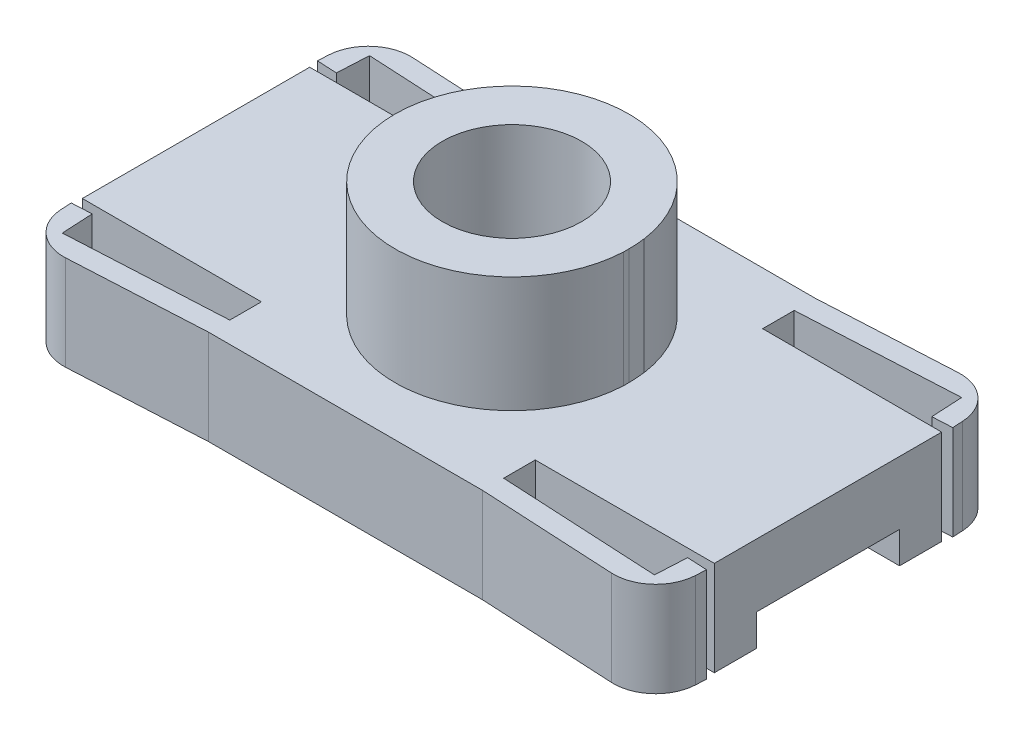
from build123d import *
from build123d.topology import SkipClean

# Parameters (mm, degrees)
BOSS_EXTRU_1_DEPTH       = 4.5
BOSS_EXTRU_2_DEPTH       = 5.5
ENL_V_MAT_EXTRU_3_DEPTH  = 2.1
ENL_V_START              = -13.1
ESQUISSE7_R              = 3
ENL_V_MAT_EXTRU_4_DEPTH  = 13.1
ESQUISSE18_W             = 8
ESQUISSE18_H             = 6.792682927
ENL_V_MAT_EXTRU_5_DEPTH  = 1.5
ESQUISSE19_W             = 8
ESQUISSE19_H             = 6.792682927
ENL_V_MAT_EXTRU_6_DEPTH  = 1.5
BOSS_EXTRU_11_DEPTH      = 4.5
ESQUISSE25_W             = 0.947664044
ESQUISSE25_H             = 4.5
BOSS_EXTRU_12_DEPTH      = 1.5
CONG_16_R                = 2
BOSS_EXTRU_16_DEPTH      = 1
ENL_V_MAT_EXTRU_7_DEPTH  = 0.25
CONG_16_OF_SYM_TRIE4_R   = 2
SYM_TRIE5_DEPTH          = 4.5
ESQUISSE34_W             = 0.75
ESQUISSE34_H             = 11.333514389
ENL_V_MAT_EXTRU_10_DEPTH = 36
ESQUISSE35_R             = 5.54436651
ESQUISSE35_R_2           = 3
BOSS_EXTRU_19_DEPTH      = 5.5
ESQUISSE36_W             = 0.010434814
ESQUISSE36_H             = 5.5
ENL_V_MAT_EXTRU_11_DEPTH = 0.25
BOSS_EXTRU_20_DEPTH      = 5.5
ESQUISSE38_W             = 0.005685697
ESQUISSE38_H             = 5.5
ENL_V_MAT_EXTRU_12_DEPTH = 36
ESQUISSE39_R             = 3.307933445
ENL_V_MAT_EXTRU_13_DEPTH = 5.5
ENL_V_START_2            = -36
ESQUISSE40_R             = 3.307933445
ENL_V_MAT_EXTRU_14_DEPTH = 36


with BuildPart() as part:
    # Esquisse1 → Boss.-Extru.1 (new body)
    with BuildSketch(Plane(origin=(0, 0, 0), x_dir=(1, 0, 0), z_dir=(0, 1, 0))):
        Polygon((21.5, 0), (21.5, 2.5), (8.5, 2.5), (8.5, 0), (0, 0), (0, -10.792682927), (8.5, -10.792682927), (8.5, -13.292682927), (21.5, -13.292682927), (21.5, -10.792682927), (30, -10.792682927), (30, 0), align=None)
    extrude(amount=BOSS_EXTRU_1_DEPTH)

    # Esquisse2 → Boss.-Extru.2 (add)
    with BuildSketch(Plane(origin=(0, 4.5, 0), x_dir=(1, 0, 0), z_dir=(0, 1, 0))):
        with BuildLine():
            ThreePointArc((20.55, -5.396341463), (16.884536839, -0.176090425), (10.729812288, -1.851204385))
            Line((10.729812288, -1.851204385), (12.691790426, -3.480051151))
            ThreePointArc((12.691790426, -3.480051151), (16.018668562, -2.574584145), (18, -5.396341463))
            ThreePointArc((18, -5.396341463), (17.821757318, -6.415010025), (17.308209574, -7.312631776))
            Line((17.308209574, -7.312631776), (19.270187712, -8.941478542))
            ThreePointArc((19.270187712, -8.941478542), (20.220251038, -7.280878303), (20.55, -5.396341463))
        make_face()
        with BuildLine():
            Line((12.691790426, -3.480051151), (10.729812288, -1.851204385))
            ThreePointArc((10.729812288, -1.851204385), (11.454862922, -9.666529176), (19.270187712, -8.941478542))
            Line((19.270187712, -8.941478542), (17.308209574, -7.312631776))
            ThreePointArc((17.308209574, -7.312631776), (13.083709687, -7.704551038), (12.691790426, -3.480051151))
        make_face()
        with BuildLine():
            ThreePointArc((20.55, -5.396341463), (16.884536839, -0.176090425), (10.729812288, -1.851204385))
            Line((10.729812288, -1.851204385), (12.691790426, -3.480051151))
            ThreePointArc((12.691790426, -3.480051151), (16.018668562, -2.574584145), (18, -5.396341463))
            ThreePointArc((18, -5.396341463), (17.821757318, -6.415010025), (17.308209574, -7.312631776))
            Line((17.308209574, -7.312631776), (19.270187712, -8.941478542))
            ThreePointArc((19.270187712, -8.941478542), (20.220251038, -7.280878303), (20.55, -5.396341463))
        make_face()
        with BuildLine():
            Line((12.691790426, -3.480051151), (10.729812288, -1.851204385))
            ThreePointArc((10.729812288, -1.851204385), (11.454862922, -9.666529176), (19.270187712, -8.941478542))
            Line((19.270187712, -8.941478542), (17.308209574, -7.312631776))
            ThreePointArc((17.308209574, -7.312631776), (13.083709687, -7.704551038), (12.691790426, -3.480051151))
        make_face()
    extrude(amount=BOSS_EXTRU_2_DEPTH)

    # Esquisse5 → Enlèv. mat.-Extru.3 (cut)
    with BuildSketch(Plane.XZ):
        with BuildLine():
            ThreePointArc((20.5, 5.396341463), (16.86755903, 10.569563213), (10.768282447, 8.90954037))
            Line((10.768282447, 8.90954037), (19.231717553, 1.883142557))
            ThreePointArc((19.231717553, 1.883142557), (20.17322175, 3.528782433), (20.5, 5.396341463))
        make_face()
        with BuildLine():
            Line((19.231717553, 1.883142557), (10.768282447, 8.90954037))
            ThreePointArc((10.768282447, 8.90954037), (11.486801094, 1.164623911), (19.231717553, 1.883142557))
        make_face()
        with BuildLine():
            ThreePointArc((20.5, 5.396341463), (16.86755903, 10.569563213), (10.768282447, 8.90954037))
            Line((10.768282447, 8.90954037), (19.231717553, 1.883142557))
            ThreePointArc((19.231717553, 1.883142557), (20.17322175, 3.528782433), (20.5, 5.396341463))
        make_face()
        with BuildLine():
            Line((19.231717553, 1.883142557), (10.768282447, 8.90954037))
            ThreePointArc((10.768282447, 8.90954037), (11.486801094, 1.164623911), (19.231717553, 1.883142557))
        make_face()
    extrude(amount=-ENL_V_MAT_EXTRU_3_DEPTH, mode=Mode.SUBTRACT)

    # Esquisse7 → Enlèv. mat.-Extru.4 (cut)
    with BuildSketch(Plane(origin=(0, 4.5, 0), x_dir=(1, 0, 0), z_dir=(0, 1, 0)).offset(ENL_V_START)):
        with Locations(Location((15, -5.396341463, 0), (0, 0, 90))):
            Circle(ESQUISSE7_R)
    extrude(amount=ENL_V_MAT_EXTRU_4_DEPTH, mode=Mode.SUBTRACT)

    # Esquisse18 → Enlèv. mat.-Extru.5 (cut)
    with BuildSketch(Plane.XZ):
        with Locations((26, 5.396341464)):
            Rectangle(ESQUISSE18_W, ESQUISSE18_H)
    extrude(amount=-ENL_V_MAT_EXTRU_5_DEPTH, mode=Mode.SUBTRACT)

    # Esquisse19 → Enlèv. mat.-Extru.6 (cut)
    with BuildSketch(Plane.XZ):
        with Locations((4, 5.396341464)):
            Rectangle(ESQUISSE19_W, ESQUISSE19_H)
    extrude(amount=-ENL_V_MAT_EXTRU_6_DEPTH, mode=Mode.SUBTRACT)

    # Esquisse23 → Boss.-Extru.11 (add)
    with BuildSketch(Plane(origin=(0, 4.5, 0), x_dir=(1, 0, 0), z_dir=(0, 1, 0))):
        Polygon((21.5, 2.5), (30, 2.945466124), (30, 1.945466124), (21.5, 1.5), align=None)
    boss_extru_11 = extrude(amount=-BOSS_EXTRU_11_DEPTH)

    # Esquisse25 → Boss.-Extru.12 (add)
    with BuildSketch(Plane(origin=(-0.019506723, 0, -0.372210441), x_dir=(0.998629534754574, 0, -0.05233595624294039), z_dir=(0.05233595624294039, 0, 0.9986295347545742))):
        with Locations((29.586871851, 2.25)):
            Rectangle(ESQUISSE25_W, ESQUISSE25_H)
    boss_extru_12 = extrude(amount=BOSS_EXTRU_12_DEPTH)

    # Congé16
    cong_16_edges = [part.edges().sort_by_distance(p)[0] for p in [
        (30, 2.25, -2.945466124),
    ]]
    fillet(cong_16_edges, radius=CONG_16_R)

    # Esquisse3D3 → Boss.-Extru.16 (add)
    with SkipClean():  # the faces are left unmerged after this step: merging them gives an invalid solid
        with BuildSketch(Plane(origin=(15, 4.5, 5.646341463), x_dir=(0.9055110385022749, 0.42432270638104186, 1.6236855905047217e-15), z_dir=(0, 0, -1))):
            Polygon((0, 0), (21.900590549, 10.262622385), (26.709658048, 0), (4.809067498, -10.262622385), align=None)
        extrude(amount=BOSS_EXTRU_16_DEPTH)

    # Esquisse29 → Enlèv. mat.-Extru.7 (cut)
    with BuildSketch(Plane.XY.offset(5.646341463)):
        Polygon((17.989565186, 4.5), (17.989565186, 10), (20.54436651, 10), (20.54436651, 4.5), (30, 4.5), (39.185890197, 4.5), (39.185890197, 15.833514389), (15, 15.833514389), (15, 4.5), align=None)
    extrude(amount=-ENL_V_MAT_EXTRU_7_DEPTH, mode=Mode.SUBTRACT)

    # Symétrie4: Boss.-Extru.11, Boss.-Extru.12 across plane
    add(boss_extru_11.mirror(Plane.XY.offset(5.396341463)))
    add(boss_extru_12.mirror(Plane.XY.offset(5.396341463)))

    # Congé16 of Symétrie4
    cong_16_of_sym_trie4_edges = [part.edges().sort_by_distance(p)[0] for p in [
        (30, 2.25, 13.738149051),
    ]]
    fillet(cong_16_of_sym_trie4_edges, radius=CONG_16_OF_SYM_TRIE4_R)

    # Symétrie5: read off the stored shape, not the designer's step
    # Symétrie5 outline → Symétrie5 (add)
    with BuildSketch(Plane(origin=(0, 0, 0), x_dir=(1, 0, 0), z_dir=(0, 1, 0))):
        with BuildLine():
            Line((8.5, -13.292682927), (8.5, -12.292682927))
            Line((8.5, -12.292682927), (0.946365303, -12.688552147))
            Line((0.946365303, -12.688552147), (0.867861369, -11.190607845))
            Line((0.867861369, -11.190607845), (-0.078503934, -11.240204749))
            Line((-0.078503934, -11.240204749), (-0.052407681, -11.738150929))
            ThreePointArc((-0.052407681, -11.738150929), (0.606590176, -13.119768667), (2.049523301, -13.630738086))
            Line((2.049523301, -13.630738086), (8.5, -13.292682927))
        make_face()
        with BuildLine():
            Line((0.946365303, 1.89586922), (8.5, 1.5))
            Line((8.5, 1.5), (8.5, 2.5))
            Line((8.5, 2.5), (2.049523301, 2.838055159))
            ThreePointArc((2.049523301, 2.838055159), (0.606590176, 2.327085741), (-0.052407681, 0.945468002))
            Line((-0.052407681, 0.945468002), (-0.078503934, 0.447521822))
            Line((-0.078503934, 0.447521822), (0.867861369, 0.397924918))
            Line((0.867861369, 0.397924918), (0.946365303, 1.89586922))
        make_face()
    extrude(amount=SYM_TRIE5_DEPTH)

    # Esquisse34 → Enlèv. mat.-Extru.10 (cut)
    with SkipClean():  # the faces are left unmerged after this step: merging them gives an invalid solid
        with BuildSketch(Plane.ZY.offset(-15)):
            with Locations((5.021341463, 10.166757195)):
                Rectangle(ESQUISSE34_W, ESQUISSE34_H)
        extrude(amount=-ENL_V_MAT_EXTRU_10_DEPTH, mode=Mode.SUBTRACT)

    # Esquisse35 → Boss.-Extru.19 (add)
    with BuildSketch(Plane(origin=(0, 4.5, 0), x_dir=(1, 0, 0), z_dir=(0, 1, 0))):
        with Locations((15, -5.396341463)):
            Circle(ESQUISSE35_R)
        with Locations(Location((15, -5.396341463, 0), (0, 0, 90))):
            Circle(ESQUISSE35_R_2, mode=Mode.SUBTRACT)
    extrude(amount=BOSS_EXTRU_19_DEPTH)

    # Esquisse36 → Enlèv. mat.-Extru.11 (cut)
    with SkipClean():  # the faces are left unmerged after this step: merging them gives an invalid solid
        with BuildSketch(Plane(origin=(0, 0, 5.396341463), x_dir=(-1, 0, 0), z_dir=(0, 0, -1))):
            with Locations((-17.994782593, 7.25)):
                Rectangle(ESQUISSE36_W, ESQUISSE36_H)
        extrude(amount=-ENL_V_MAT_EXTRU_11_DEPTH, mode=Mode.SUBTRACT)

    # Esquisse37 → Boss.-Extru.20 (add)
    with SkipClean():  # the faces are left unmerged after this step: merging them gives an invalid solid
        with BuildSketch(Plane(origin=(0, 4.5, 0), x_dir=(1, 0, 0), z_dir=(0, 1, 0))):
            with BuildLine():
                Line((17.989565186, -5.646341463), (18, -5.646341463))
                Line((18, -5.646341463), (18, -5.396341463))
                ThreePointArc((18, -5.396341463), (17.997390161, -5.521450301), (17.989565186, -5.646341463))
            make_face()
        extrude(amount=BOSS_EXTRU_20_DEPTH)

    # Esquisse38 → Enlèv. mat.-Extru.12 (cut)
    with SkipClean():  # the faces are left unmerged after this step: merging them gives an invalid solid
        with BuildSketch(Plane.XY.offset(4.646341463)):
            with Locations((20.496247985, 7.25)):
                Rectangle(ESQUISSE38_W, ESQUISSE38_H)
        extrude(amount=-ENL_V_MAT_EXTRU_12_DEPTH, mode=Mode.SUBTRACT)

    # Esquisse39 → Enlèv. mat.-Extru.13 (cut)
    with BuildSketch(Plane(origin=(0, 4.5, 0), x_dir=(1, 0, 0), z_dir=(0, 1, 0))):
        with Locations(Location((15, -5.396341463, 0), (0, 0, 270))):
            Circle(ESQUISSE39_R)
    extrude(amount=ENL_V_MAT_EXTRU_13_DEPTH, mode=Mode.SUBTRACT)

    # Esquisse40 → Enlèv. mat.-Extru.14 (cut)
    with BuildSketch(Plane(origin=(0, 4.5, 0), x_dir=(1, 0, 0), z_dir=(0, 1, 0)).offset(ENL_V_START_2)):
        with Locations(Location((15, -5.396341463, 0), (0, 0, 90))):
            Circle(ESQUISSE40_R)
    extrude(amount=ENL_V_MAT_EXTRU_14_DEPTH, mode=Mode.SUBTRACT)


solid = part.part
